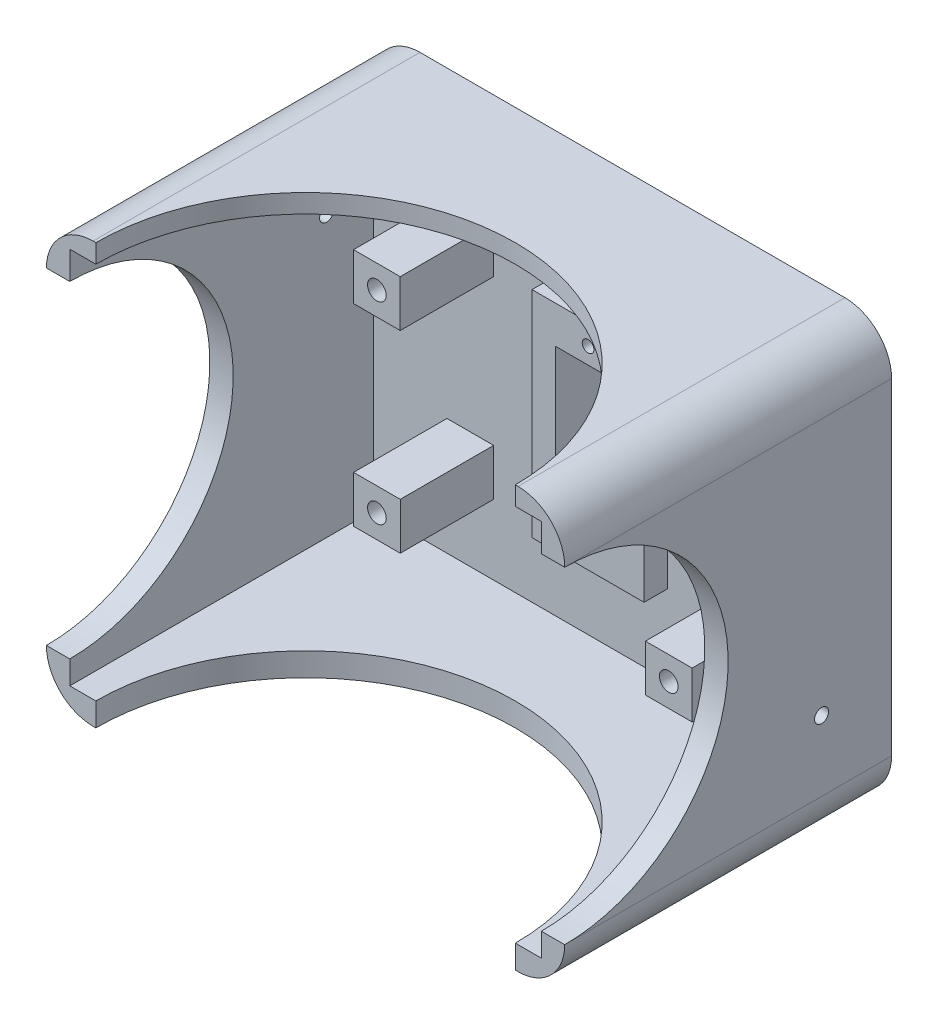
from build123d import *

# Parameters (mm, degrees)
ESQUISSE1_W             = 111
ESQUISSE1_H             = 90
ESQUISSE1_W_2           = 101
ESQUISSE1_H_2           = 81
BOSS_EXTRU_1_DEPTH      = 70
ESQUISSE1_35_W          = 101
ESQUISSE1_35_H          = 81
ESQUISSE1_35_W_2        = 10
ESQUISSE1_35_H_2        = 10
ESQUISSE1_35_W_3        = 24
ESQUISSE1_35_H_3        = 46
BOSS_EXTRU_2_DEPTH      = 5
ESQUISSE1_37_W          = 10
ESQUISSE1_37_H          = 10
ESQUISSE1_37_W_2        = 24
ESQUISSE1_37_H_2        = 46
BOSS_EXTRU_5_DEPTH      = 1
ESQUISSE1_38_W          = 10
ESQUISSE1_38_H          = 10
ESQUISSE1_38_W_2        = 24
ESQUISSE1_38_H_2        = 46
BOSS_EXTRU_6_DEPTH      = 5
CONG_1_R                = 10
CONG_2_R                = 10
CONG_4_R                = 10
CONG_5_R                = 10
ESQUISSE3_R             = 44.917746465
ENL_V_MAT_EXTRU_2_DEPTH = 111
ESQUISSE4_R             = 35
ENL_V_MAT_EXTRU_3_DEPTH = 111
ESQUISSE5_R             = 1.5
ENL_V_MAT_EXTRU_6_DEPTH = 5
ESQUISSE8_R             = 1.5
ENL_V_MAT_EXTRU_7_DEPTH = 15
ESQUISSE1_44_W          = 24
ESQUISSE1_44_H          = 46
ESQUISSE1_44_R          = 1.25
ESQUISSE1_44_W_2        = 14
ESQUISSE1_44_H_2        = 30
BOSS_EXTRU_9_DEPTH      = 10
ESQUISSE1_45_W          = 10
ESQUISSE1_45_H          = 10
ESQUISSE1_45_R          = 2
BOSS_EXTRU_10_DEPTH     = 25
ESQUISSE1_46_R          = 2
BOSS_EXTRU_11_DEPTH     = 10
ESQUISSE1_51_R          = 1.25
BOSS_EXTRU_12_DEPTH     = 5


with BuildPart() as part:
    # Esquisse1 → Boss.-Extru.1 (new body)
    with BuildSketch(Plane.XY):
        with Locations((-56.493976651, -27.403873598)):
            Rectangle(ESQUISSE1_W, ESQUISSE1_H)
        with Locations((-56.493976651, -26.903873598)):
            Rectangle(ESQUISSE1_W_2, ESQUISSE1_H_2, mode=Mode.SUBTRACT)
    extrude(amount=BOSS_EXTRU_1_DEPTH)

    # Esquisse1<35> → Boss.-Extru.2 (add)
    with BuildSketch(Plane.XY):
        with Locations((-56.493976651, -26.903873598)):
            Rectangle(ESQUISSE1_35_W, ESQUISSE1_35_H)
        with Locations((-23.714445802, -47.459966607)):
            Rectangle(ESQUISSE1_35_W_2, ESQUISSE1_35_H_2, mode=Mode.SUBTRACT)
        with Locations((-86.220389644, -6.113390136)):
            Rectangle(ESQUISSE1_35_W_2, ESQUISSE1_35_H_2, mode=Mode.SUBTRACT)
        with Locations((-23.720406999, -6.159966607)):
            Rectangle(ESQUISSE1_35_W_2, ESQUISSE1_35_H_2, mode=Mode.SUBTRACT)
        with Locations((-86.214445802, -47.413390136)):
            Rectangle(ESQUISSE1_35_W_2, ESQUISSE1_35_H_2, mode=Mode.SUBTRACT)
        with Locations((-55.993976651, -27.403873598)):
            Rectangle(ESQUISSE1_35_W_3, ESQUISSE1_35_H_3, mode=Mode.SUBTRACT)
    extrude(amount=BOSS_EXTRU_2_DEPTH)

    # Esquisse1<37> → Boss.-Extru.5 (add)
    with BuildSketch(Plane.XY):
        Polygon((-91.993976651, 7.596126402), (-101.993976651, 7.596126402), (-101.993976651, -2.403873598), (-101.993976651, -52.403873598), (-101.993976651, -62.403873598), (-91.993976651, -62.403873598), (-20.993976651, -62.403873598), (-10.993976651, -62.403873598), (-10.993976651, -52.403873598), (-10.993976651, -2.403873598), (-10.993976651, 7.596126402), (-20.993976651, 7.596126402), align=None)
        with Locations((-86.214445802, -47.413390136)):
            Rectangle(ESQUISSE1_37_W, ESQUISSE1_37_H, mode=Mode.SUBTRACT)
        with Locations((-55.993976651, -27.403873598)):
            Rectangle(ESQUISSE1_37_W_2, ESQUISSE1_37_H_2, mode=Mode.SUBTRACT)
        with Locations((-23.714445802, -47.459966607)):
            Rectangle(ESQUISSE1_37_W, ESQUISSE1_37_H, mode=Mode.SUBTRACT)
        with Locations((-86.220389644, -6.113390136)):
            Rectangle(ESQUISSE1_37_W, ESQUISSE1_37_H, mode=Mode.SUBTRACT)
        with Locations((-23.720406999, -6.159966607)):
            Rectangle(ESQUISSE1_37_W, ESQUISSE1_37_H, mode=Mode.SUBTRACT)
    extrude(amount=BOSS_EXTRU_5_DEPTH)

    # Esquisse1<38> → Boss.-Extru.6 (add)
    with BuildSketch(Plane.XY):
        Polygon((-91.993976651, 7.596126402), (-101.993976651, 7.596126402), (-101.993976651, -2.403873598), (-101.993976651, -52.403873598), (-101.993976651, -62.403873598), (-91.993976651, -62.403873598), (-20.993976651, -62.403873598), (-10.993976651, -62.403873598), (-10.993976651, -52.403873598), (-10.993976651, -2.403873598), (-10.993976651, 7.596126402), (-20.993976651, 7.596126402), align=None)
        with Locations((-86.214445802, -47.413390136)):
            Rectangle(ESQUISSE1_38_W, ESQUISSE1_38_H, mode=Mode.SUBTRACT)
        with Locations((-55.993976651, -27.403873598)):
            Rectangle(ESQUISSE1_38_W_2, ESQUISSE1_38_H_2, mode=Mode.SUBTRACT)
        with Locations((-23.714445802, -47.459966607)):
            Rectangle(ESQUISSE1_38_W, ESQUISSE1_38_H, mode=Mode.SUBTRACT)
        with Locations((-86.220389644, -6.113390136)):
            Rectangle(ESQUISSE1_38_W, ESQUISSE1_38_H, mode=Mode.SUBTRACT)
        with Locations((-23.720406999, -6.159966607)):
            Rectangle(ESQUISSE1_38_W, ESQUISSE1_38_H, mode=Mode.SUBTRACT)
    extrude(amount=BOSS_EXTRU_6_DEPTH)

    # Congé1
    cong_1_edges = [part.edges().sort_by_distance(p)[0] for p in [
        (-111.993976651, -72.403873598, 35),
    ]]
    fillet(cong_1_edges, radius=CONG_1_R)

    # Congé2
    cong_2_edges = [part.edges().sort_by_distance(p)[0] for p in [
        (-111.993976651, 17.596126402, 35),
    ]]
    fillet(cong_2_edges, radius=CONG_2_R)

    # Congé4
    cong_4_edges = [part.edges().sort_by_distance(p)[0] for p in [
        (-0.993976651, 17.596126402, 35),
    ]]
    fillet(cong_4_edges, radius=CONG_4_R)

    # Congé5
    cong_5_edges = [part.edges().sort_by_distance(p)[0] for p in [
        (-0.993976651, -72.403873598, 35),
    ]]
    fillet(cong_5_edges, radius=CONG_5_R)

    # Esquisse3 → Enlèv. mat.-Extru.2 (cut)
    with BuildSketch(Plane.XZ.offset(72.403873598)):
        with Locations((-56.493976651, 70)):
            Circle(ESQUISSE3_R)
    extrude(amount=-ENL_V_MAT_EXTRU_2_DEPTH, mode=Mode.SUBTRACT)

    # Esquisse4 → Enlèv. mat.-Extru.3 (cut)
    with BuildSketch(Plane(origin=(-0.993976651, 0, 0), x_dir=(0, 0, -1), z_dir=(1, 0, 0))):
        with Locations((-70, -27.403873598)):
            Circle(ESQUISSE4_R)
    extrude(amount=-ENL_V_MAT_EXTRU_3_DEPTH, mode=Mode.SUBTRACT)

    # Esquisse5 → Enlèv. mat.-Extru.6 (cut)
    with BuildSketch(Plane.ZY.offset(111.993976651)):
        with Locations((15, -7.403873598)):
            Circle(ESQUISSE5_R)
    extrude(amount=-ENL_V_MAT_EXTRU_6_DEPTH, mode=Mode.SUBTRACT)

    # Esquisse8 → Enlèv. mat.-Extru.7 (cut)
    with BuildSketch(Plane(origin=(-0.993976651, 0, 0), x_dir=(0, 0, -1), z_dir=(1, 0, 0))):
        with Locations((-15, -47.403873598)):
            Circle(ESQUISSE8_R)
    extrude(amount=-ENL_V_MAT_EXTRU_7_DEPTH, mode=Mode.SUBTRACT)

    # Esquisse1<44> → Boss.-Extru.9 (add)
    with BuildSketch(Plane.XY):
        with Locations((-55.993976651, -27.403873598)):
            Rectangle(ESQUISSE1_44_W, ESQUISSE1_44_H)
        with Locations((-55.993976651, -45.903873598)):
            Circle(ESQUISSE1_44_R, mode=Mode.SUBTRACT)
        with Locations((-55.993976651, -27.403873598)):
            Rectangle(ESQUISSE1_44_W_2, ESQUISSE1_44_H_2, mode=Mode.SUBTRACT)
        with Locations((-55.993976651, -8.903873598)):
            Circle(ESQUISSE1_44_R, mode=Mode.SUBTRACT)
    extrude(amount=BOSS_EXTRU_9_DEPTH)

    # Esquisse1<45> → Boss.-Extru.10 (add)
    # profile 1 of 4: a face of its own
    with BuildSketch(Plane.XY):
        with Locations((-86.220389644, -6.113390136)):
            Rectangle(ESQUISSE1_45_W, ESQUISSE1_45_H)
        with Locations((-86.220389644, -6.113390136)):
            Circle(ESQUISSE1_45_R, mode=Mode.SUBTRACT)
    # profile 2 of 4: a face of its own
    with BuildSketch(Plane.XY):
        with Locations((-23.720406999, -6.159966607)):
            Rectangle(ESQUISSE1_45_W, ESQUISSE1_45_H)
        with Locations((-23.720406999, -6.159966607)):
            Circle(ESQUISSE1_45_R, mode=Mode.SUBTRACT)
    # profile 3 of 4: a face of its own
    with BuildSketch(Plane.XY):
        with Locations((-23.714445802, -47.459966607)):
            Rectangle(ESQUISSE1_45_W, ESQUISSE1_45_H)
        with Locations((-23.714445802, -47.459966607)):
            Circle(ESQUISSE1_45_R, mode=Mode.SUBTRACT)
    # profile 4 of 4: a face of its own
    with BuildSketch(Plane.XY):
        with Locations((-86.214445802, -47.413390136)):
            Rectangle(ESQUISSE1_45_W, ESQUISSE1_45_H)
        with Locations((-86.214445802, -47.413390136)):
            Circle(ESQUISSE1_45_R, mode=Mode.SUBTRACT)
    extrude(amount=BOSS_EXTRU_10_DEPTH)

    # Esquisse1<46> → Boss.-Extru.11 (add)
    with BuildSketch(Plane.XY):
        with Locations((-86.220389644, -6.113390136)):
            Circle(ESQUISSE1_46_R)
        with Locations((-23.720406999, -6.159966607)):
            Circle(ESQUISSE1_46_R)
        with Locations((-86.214445802, -47.413390136)):
            Circle(ESQUISSE1_46_R)
        with Locations((-23.714445802, -47.459966607)):
            Circle(ESQUISSE1_46_R)
    extrude(amount=BOSS_EXTRU_11_DEPTH)

    # Esquisse1<51> → Boss.-Extru.12 (add)
    with BuildSketch(Plane.XY):
        with Locations((-55.993976651, -45.903873598)):
            Circle(ESQUISSE1_51_R)
        with Locations((-55.993976651, -8.903873598)):
            Circle(ESQUISSE1_51_R)
    extrude(amount=BOSS_EXTRU_12_DEPTH)


solid = part.part
